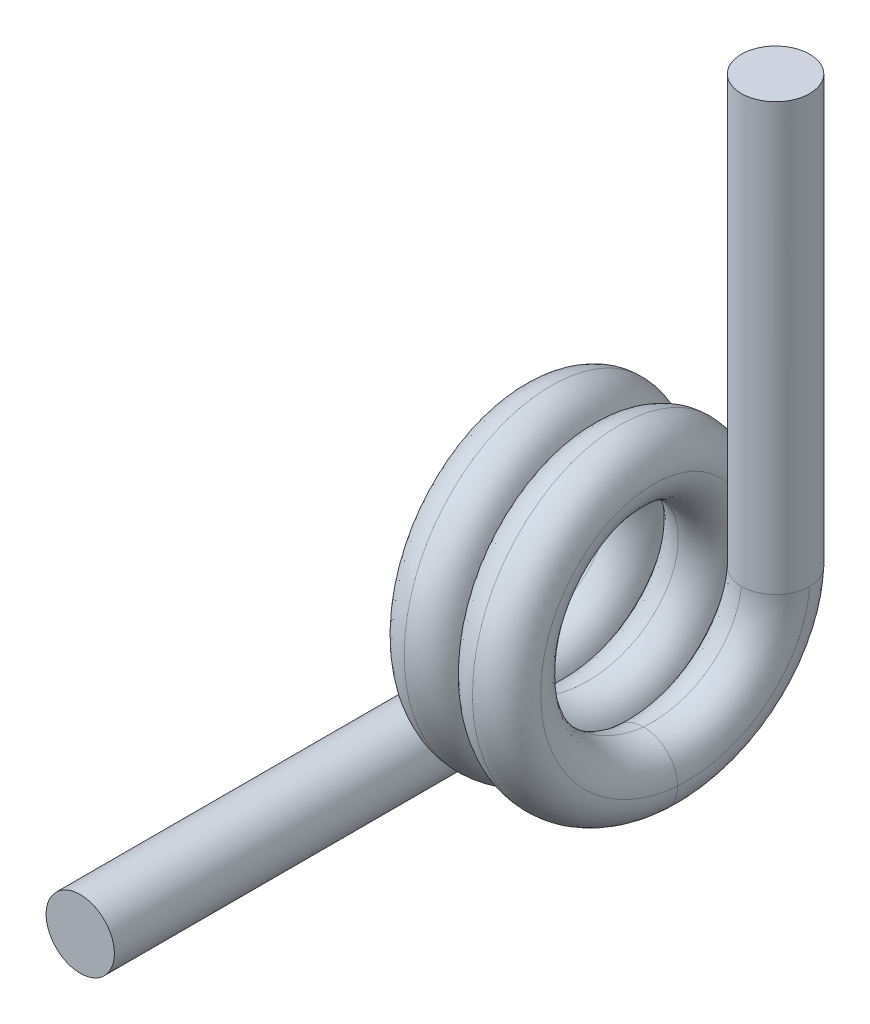
from build123d import *

# Parameters (mm, degrees)
SKETCH1_R                   = 0.5206999999999999
HORIZONTAL_EXTENSION_DEPTH  = 2.34315
MAIN_HELIX_SWEEP_PITCH      = 1.041399999999998
SECONDARY_HELIX_SWEEP_PITCH = 0.761999999999999
VERTICAL_EXTENSION_DEPTH    = 2.34315
SKETCH12_R                  = 0.5207000000000012
VERTICAL_ARM_DEPTH          = 4.1656
HORIZONTAL_START            = 4.1656
SKETCH13_R                  = 0.5206999999999999
HORIZONTAL_ARM_DEPTH        = 4.1656


with BuildPart() as part:
    # Sketch1 → Horizontal Extension (new body)
    with BuildSketch(Plane.XY):
        Circle(SKETCH1_R)
    extrude(amount=-HORIZONTAL_EXTENSION_DEPTH)

    # Main Helix Sweep: the profile of Sketch4 screwed along a right-hand helix of 2 turns, 8 arcs to a turn; built about Z, then put on its axis
    main_helix_sweep_z = Axis((0, 0, 0), (0, 0, 1))
    main_helix_sweep_corners = [(1.82245, 0, -0.5207), (1.30175, 0, 0), (1.82245, 0, 0.5207), (2.34315, 0, 0)]
    with BuildLine(mode=Mode.PRIVATE) as main_helix_sweep_profile:
        ThreePointArc((1.82245, 0, -0.5207), (1.454259499, 0, -0.368190501), (1.30175, 0, 0))
        ThreePointArc((1.30175, 0, 0), (1.454259499, 0, 0.368190501), (1.82245, 0, 0.5207))
        ThreePointArc((1.82245, 0, 0.5207), (2.190640501, 0, 0.368190501), (2.34315, 0, 0))
        ThreePointArc((2.34315, 0, 0), (2.190640501, 0, -0.368190501), (1.82245, 0, -0.5207))
    main_helix_sweep_cap = Face(main_helix_sweep_profile.wire())
    main_helix_sweep_arcs = [((1.82245, 0, -0.5207), (1.30175, 0, -0.5207), (1.30175, 0, 0), (1, 0.7071067811865476, 1)), ((1.30175, 0, 0), (1.30175, 0, 0.5207), (1.82245, 0, 0.5207), (1, 0.7071067811865476, 1)), ((1.82245, 0, 0.5207), (2.34315, 0, 0.5207), (2.34315, 0, 0), (1, 0.7071067811865476, 1)), ((2.34315, 0, 0), (2.34315, 0, -0.5207), (1.82245, 0, -0.5207), (1, 0.7071067811865476, 1))]  # start, shoulder, end, weights
    main_helix_sweep_turn_angles = [0, 22.5, 45, 67.5, 90, 112.5, 135, 157.5, 180, 202.5, 225, 247.5, 270, 292.5, 315, 337.5, 360]
    main_helix_sweep_turn_weights = [1, 0.9238795325112867, 1, 0.9238795325112867, 1, 0.9238795325112867, 1, 0.9238795325112867, 1, 0.9238795325112867, 1, 0.9238795325112867, 1, 0.9238795325112867, 1, 0.9238795325112867, 1]
    main_helix_sweep_turn_sides = [Face.make_bezier_surface([[Vector(p[j][0], p[j][1], 0).rotate(main_helix_sweep_z, main_helix_sweep_turn_angles[2 * i + k]) / main_helix_sweep_turn_weights[2 * i + k] + Vector(0, 0, p[j][2] + MAIN_HELIX_SWEEP_PITCH * main_helix_sweep_turn_angles[2 * i + k] / 360) for k in range(3)] for j in range(3)], [[p[3][j] * main_helix_sweep_turn_weights[2 * i + k] for k in range(3)] for j in range(3)]) for p in main_helix_sweep_arcs for i in range(8)]
    main_helix_sweep_turn = Solid(Shell([*main_helix_sweep_turn_sides, main_helix_sweep_cap, main_helix_sweep_cap.rotate(main_helix_sweep_z, 360).moved(Location((0, 0, MAIN_HELIX_SWEEP_PITCH * 360 / 360)))]))
    main_helix_sweep_each = [*[main_helix_sweep_turn.moved(Location((0, 0, MAIN_HELIX_SWEEP_PITCH * i))) for i in range(2)]]
    add(Plane(origin=(0, 1.8224500000000001, -2.34315), x_dir=(0, -1, -1.055e-14), z_dir=(1, 0, 0)) * Compound([main_helix_sweep_each[i] for i in range(0, 2, 2)]))
    add(Plane(origin=(0, 1.8224500000000001, -2.34315), x_dir=(0, -1, -1.055e-14), z_dir=(1, 0, 0)) * Compound([main_helix_sweep_each[i] for i in range(1, 2, 2)]))


with BuildPart() as body_2:
    # Secondary Helix Sweep: the profile of Sketch5 screwed along a right-hand helix of 0.25 turns, 8 arcs to a turn; built about Z, then put on its axis
    secondary_helix_sweep_z = Axis((0, 0, 0), (0, 0, 1))
    secondary_helix_sweep_corners = [(1.82245, 0, 0.5207), (2.34315, 0, 0), (1.82245, 0, -0.5207), (1.30175, 0, 0)]
    with BuildLine(mode=Mode.PRIVATE) as secondary_helix_sweep_profile:
        ThreePointArc((1.82245, 0, 0.5207), (2.190640501, 0, 0.368190501), (2.34315, 0, 0))
        ThreePointArc((2.34315, 0, 0), (2.190640501, 0, -0.368190501), (1.82245, 0, -0.5207))
        ThreePointArc((1.82245, 0, -0.5207), (1.454259499, 0, -0.368190501), (1.30175, 0, 0))
        ThreePointArc((1.30175, 0, 0), (1.454259499, 0, 0.368190501), (1.82245, 0, 0.5207))
    secondary_helix_sweep_cap = Face(secondary_helix_sweep_profile.wire())
    secondary_helix_sweep_arcs = [((1.82245, 0, 0.5207), (2.34315, 0, 0.5207), (2.34315, 0, 0), (1, 0.7071067811865448, 1)), ((2.34315, 0, 0), (2.34315, 0, -0.5207), (1.82245, 0, -0.5207), (1, 0.7071067811865539, 1)), ((1.82245, 0, -0.5207), (1.30175, 0, -0.5207), (1.30175, 0, 0), (1, 0.707106781186549, 1)), ((1.30175, 0, 0), (1.30175, 0, 0.5207), (1.82245, 0, 0.5207), (1, 0.7071067811865419, 1))]  # start, shoulder, end, weights
    secondary_helix_sweep_turn_angles = [0, 22.5, 45, 67.5, 90]
    secondary_helix_sweep_turn_weights = [1, 0.9238795325112867, 1, 0.9238795325112862, 1]
    secondary_helix_sweep_turn_sides = [Face.make_bezier_surface([[Vector(p[j][0], p[j][1], 0).rotate(secondary_helix_sweep_z, secondary_helix_sweep_turn_angles[2 * i + k]) / secondary_helix_sweep_turn_weights[2 * i + k] + Vector(0, 0, p[j][2] + SECONDARY_HELIX_SWEEP_PITCH * secondary_helix_sweep_turn_angles[2 * i + k] / 360) for k in range(3)] for j in range(3)], [[p[3][j] * secondary_helix_sweep_turn_weights[2 * i + k] for k in range(3)] for j in range(3)]) for p in secondary_helix_sweep_arcs for i in range(2)]
    secondary_helix_sweep = Plane(origin=(2.082800000000001, 1.8224500000000001, -2.34315), x_dir=(0, -1, -1.055e-14), z_dir=(1, 0, 0)) * Solid(Shell([*secondary_helix_sweep_turn_sides, secondary_helix_sweep_cap, secondary_helix_sweep_cap.rotate(secondary_helix_sweep_z, 90).moved(Location((0, 0, SECONDARY_HELIX_SWEEP_PITCH * 90 / 360)))]))
    add(secondary_helix_sweep)


with BuildPart() as body_3:
    # Sketch10 → Vertical Extension (new body)
    with BuildSketch(Plane(origin=(6.14e-15, 1.8224499999999315, 5.478e-14), x_dir=(1, -3.37e-15, 0), z_dir=(3.37e-15, 1, 3.006e-14))):
        with BuildLine():
            ThreePointArc((2.2732999999999914, 4.686300000000053), (1.9051094990361586, 4.533790500963888), (1.7525999999999944, 4.165600000000055))
            ThreePointArc((1.7525999999999944, 4.165600000000055), (1.905109499036159, 3.7974094990362195), (2.273299999999994, 3.644900000000054))
            ThreePointArc((2.273299999999994, 3.644900000000054), (2.6414905009638296, 3.7974094990362195), (2.7939999999999943, 4.1656000000000555))
            ThreePointArc((2.7939999999999943, 4.1656000000000555), (2.6414905009638283, 4.533790500963891), (2.2732999999999914, 4.686300000000053))
        make_face()
    extrude(amount=VERTICAL_EXTENSION_DEPTH)


with BuildPart() as part_1:
    add(part.part)

    # Combine: union body 2, body 3
    add(body_2.part)
    add(body_3.part)

    # Sketch12 → Vertical Arm (add)
    with BuildSketch(Plane(origin=(1.402e-14, 4.165599999999936, 1.2521e-13), x_dir=(1, -3.37e-15, 0), z_dir=(3.37e-15, 1, 3.006e-14))):
        with Locations(Location((2.273299999999993, 4.1656000000000555, 0), (0, 0, 270))):
            Circle(SKETCH12_R)
    extrude(amount=VERTICAL_ARM_DEPTH)

    # Sketch13 → Horizontal Arm (add)
    with BuildSketch(Plane.XY.offset(HORIZONTAL_START)):
        Circle(SKETCH13_R)
    extrude(amount=-HORIZONTAL_ARM_DEPTH)


solid = part_1.part
